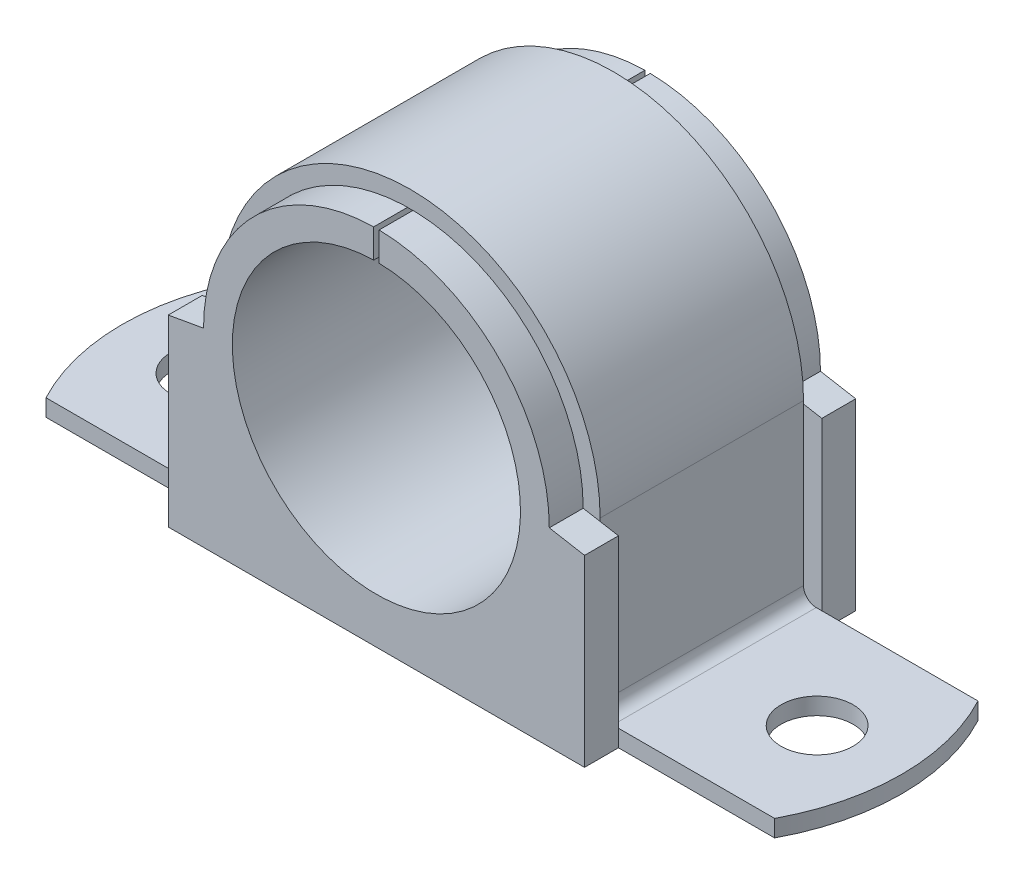
from build123d import *

# Parameters (mm, degrees)
BOSS_EXTRUDE1_DEPTH      = 9.525
SKETCH2_R                = 3.3734375
CUT_EXTRUDE1_DEPTH       = 52.842814688
BOSS_EXTRUDE2_DEPTH      = 12.7
BOSS_EXTRUDE2_DEPTH_BACK = 12.7
SKETCH3_R                = 13.49375
CUT_EXTRUDE2_START       = -9.525
SKETCH7_W                = 20.310078125
SKETCH7_H                = 17.78
CUT_EXTRUDE2_DEPTH       = 19.05
CUT_EXTRUDE3_DEPTH       = 1.5875
CUT_EXTRUDE4_DEPTH       = 53.518966191
CUT_EXTRUDE4_DEPTH_BACK  = 53.518966191
SKETCH11_W               = 0.508
SKETCH11_H               = 2.7011408


# Read off the part's stored shape, not the designer's step: Cut-Extrude3
with BuildPart() as part:
    # Sketch1 → Boss-Extrude1 (new, symmetric)
    with BuildSketch(Plane.XY):
        with BuildLine():
            Line((-36.502578125, 0), (-18.970625, 0))
            ThreePointArc((-18.970625, 0), (-17.006193974, 0.813693974), (-16.1925, 2.778125))
            Line((-16.1925, 2.778125), (-16.1925, 17.78))
            ThreePointArc((-16.1925, 17.78), (0, 33.9725), (16.1925, 17.78))
            Line((16.1925, 17.78), (16.1925, 2.778125))
            ThreePointArc((16.1925, 2.778125), (17.006193974, 0.813693974), (18.970625, 0))
            Line((18.970625, 0), (36.502578125, 0))
            Line((36.502578125, 0), (36.502578125, 1.5875))
            Line((36.502578125, 1.5875), (18.970625, 1.5875))
            ThreePointArc((18.970625, 1.5875), (18.128725989, 1.936225989), (17.78, 2.778125))
            Line((17.78, 2.778125), (17.78, 17.78))
            ThreePointArc((17.78, 17.78), (0, 35.56), (-17.78, 17.78))
            Line((-17.78, 17.78), (-17.78, 2.778125))
            ThreePointArc((-17.78, 2.778125), (-18.128725989, 1.936225989), (-18.970625, 1.5875))
            Line((-18.970625, 1.5875), (-36.502578125, 1.5875))
            Line((-36.502578125, 1.5875), (-36.502578125, 0))
        make_face()
    extrude(amount=BOSS_EXTRUDE1_DEPTH, both=True)

    # Sketch2 → Cut-Extrude1 (cut, through all)
    with BuildSketch(Plane(origin=(0, 0, 0), x_dir=(1, 0, 0), z_dir=(0, 1, 0))):
        with Locations(Location((-28.575, 0, 0), (0, 0, 90))):
            Circle(SKETCH2_R)
        with Locations((28.575, 0)):
            Circle(SKETCH2_R)
    extrude(amount=CUT_EXTRUDE1_DEPTH, mode=Mode.SUBTRACT)

    # Cut-Extrude3 outline → Cut-Extrude3 (cut)
    with BuildSketch(Plane(origin=(0, 0, 0), x_dir=(1, 0, 0), z_dir=(0, 1, 0))):
        with BuildLine():
            Line((36.502578125, 9.525), (34.121328125, 9.525))
            ThreePointArc((34.121328125, 9.525), (35.898243667, 4.909072636), (36.502578125, 0))
            Line((36.502578125, 0), (36.502578125, 9.525))
        make_face()
        with BuildLine():
            Line((36.502578125, -9.525), (36.502578125, 0))
            ThreePointArc((36.502578125, 0), (35.898243667, -4.909072636), (34.121328125, -9.525))
            Line((34.121328125, -9.525), (36.502578125, -9.525))
        make_face()
        with BuildLine():
            ThreePointArc((-36.502578125, 0), (-35.898243667, 4.909072636), (-34.121328125, 9.525))
            Line((-34.121328125, 9.525), (-36.502578125, 9.525))
            Line((-36.502578125, 9.525), (-36.502578125, 0))
        make_face()
        with BuildLine():
            ThreePointArc((-34.121328125, -9.525), (-35.898243667, -4.909072636), (-36.502578125, 0))
            Line((-36.502578125, 0), (-36.502578125, -9.525))
            Line((-36.502578125, -9.525), (-34.121328125, -9.525))
        make_face()
    extrude(amount=CUT_EXTRUDE3_DEPTH, mode=Mode.SUBTRACT)


with BuildPart() as body_2:
    # Sketch3 → Boss-Extrude2 (new, two sides: drawn at the far end of the back side and taken through both)
    with BuildSketch(Plane.XY.offset(-BOSS_EXTRUDE2_DEPTH_BACK)):
        with BuildLine():
            Line((-19.4945, 0), (19.4945, 0))
            Line((19.4945, 0), (19.4945, 17.19776831))
            Line((19.4945, 17.19776831), (16.1925, 17.78))
            ThreePointArc((16.1925, 17.78), (0, 33.9725), (-16.1925, 17.78))
            Line((-16.1925, 17.78), (-19.4945, 17.19776831))
            Line((-19.4945, 17.19776831), (-19.4945, 0))
        make_face()
        with Locations(Location((0, 17.78, 0), (0, 0, 180))):
            Circle(SKETCH3_R, mode=Mode.SUBTRACT)
    extrude(amount=BOSS_EXTRUDE2_DEPTH + BOSS_EXTRUDE2_DEPTH_BACK)

    # Sketch7 → Cut-Extrude2 (cut)
    with BuildSketch(Plane.XY.offset(CUT_EXTRUDE2_START)):
        with Locations((-26.347539063, 8.89)):
            Rectangle(SKETCH7_W, SKETCH7_H)
        with Locations((26.347539063, 8.89)):
            Rectangle(SKETCH7_W, SKETCH7_H)
    extrude(amount=CUT_EXTRUDE2_DEPTH, mode=Mode.SUBTRACT)

    # Sketch11 → Cut-Extrude4 (cut, two sides: drawn at the far end of the back side and taken through both)
    with BuildSketch(Plane.XY.offset(-CUT_EXTRUDE4_DEPTH_BACK)):
        with Locations((0, 32.6219296)):
            Rectangle(SKETCH11_W, SKETCH11_H)
    extrude(amount=CUT_EXTRUDE4_DEPTH + CUT_EXTRUDE4_DEPTH_BACK, mode=Mode.SUBTRACT)


solid = Compound([part.part, body_2.part])
